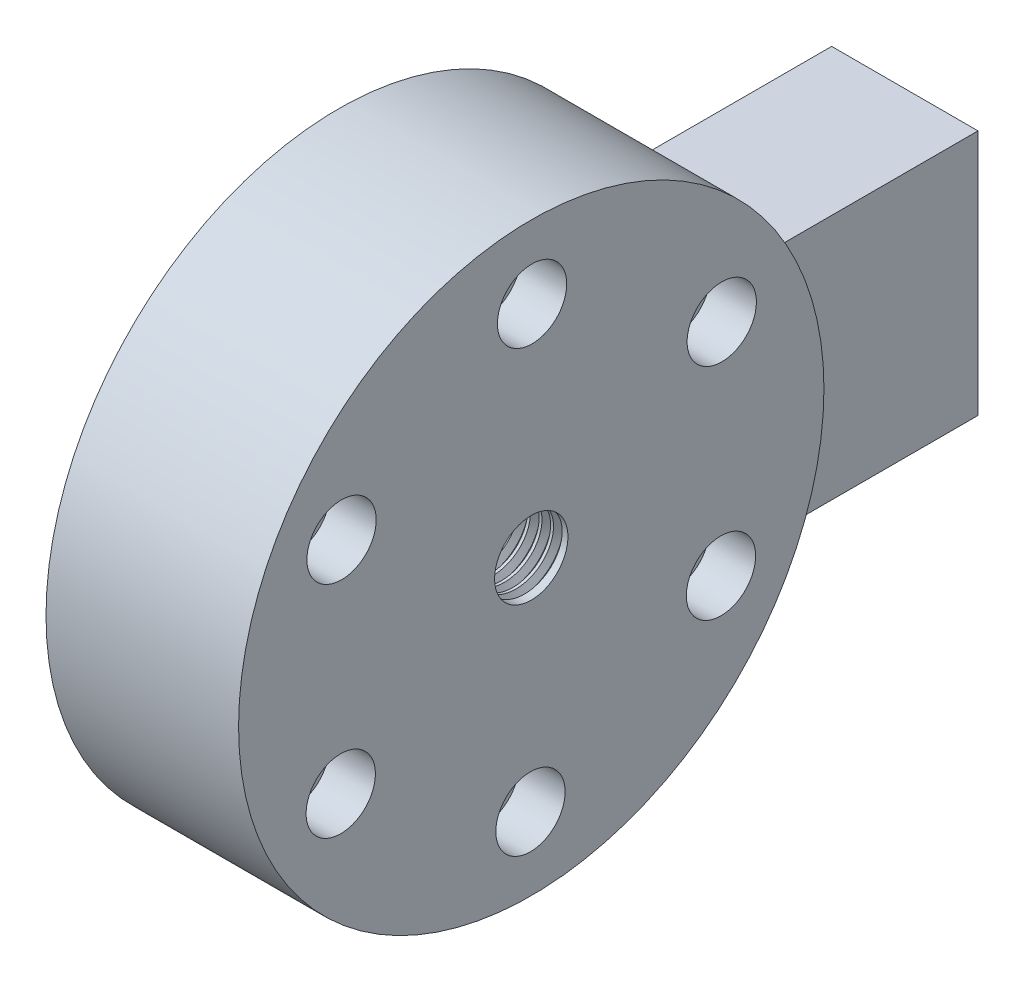
from build123d import *

# Parameters (mm, degrees)
SKETCH1_R                       = 38
BOSS_EXTRUDE1_DEPTH             = 25
SKETCH2_R                       = 3.5
CUT_EXTRUDE1_DEPTH              = 25
SKETCH3_R                       = 4.5
CUT_EXTRUDE2_DEPTH              = 6
SKETCH4_R                       = 4.7625
CUT_EXTRUDE3_DEPTH              = 60.270566
THREAD1_PITCH                   = 1.5
BOSS_EXTRUDE2_REACH             = 90.572
BOSS_EXTRUDE2_END_RADIUS        = 38
SKETCH8_W                       = 19
SKETCH8_H                       = 32
BOSS_EXTRUDE2_DIRECTION_2_DEPTH = 23


with BuildPart() as part:
    # Sketch1 → Boss-Extrude1 (new body)
    with BuildSketch(Plane(origin=(0, 0, 0), x_dir=(0, 0, -1), z_dir=(1, 0, 0))):
        Circle(SKETCH1_R)
    extrude(amount=BOSS_EXTRUDE1_DEPTH)

    # Sketch2 → Cut-Extrude1 (cut)
    with BuildSketch(Plane(origin=(25, 0, 0), x_dir=(0, 0, -1), z_dir=(1, 0, 0))):
        with Locations((0.103808, 28.499811)):
            Circle(SKETCH2_R)
        with Locations((24.733464, 14.160005)):
            Circle(SKETCH2_R)
        with Locations((24.629656, -14.339806)):
            Circle(SKETCH2_R)
        with Locations((-0.103808, -28.499811)):
            Circle(SKETCH2_R)
        with Locations((-24.733464, -14.160005)):
            Circle(SKETCH2_R)
        with Locations((-24.629656, 14.339806)):
            Circle(SKETCH2_R)
    extrude(amount=-CUT_EXTRUDE1_DEPTH, mode=Mode.SUBTRACT)

    # Sketch3 → Cut-Extrude2 (cut)
    with BuildSketch(Plane(origin=(25, 0, 0), x_dir=(0, 0, -1), z_dir=(1, 0, 0))):
        with Locations((0.103808, 28.499811)):
            Circle(SKETCH3_R)
        with Locations((24.733464, 14.160005)):
            Circle(SKETCH3_R)
        with Locations((24.629656, -14.339806)):
            Circle(SKETCH3_R)
        with Locations((-0.103808, -28.499811)):
            Circle(SKETCH3_R)
        with Locations((-24.733464, -14.160005)):
            Circle(SKETCH3_R)
        with Locations((-24.629656, 14.339806)):
            Circle(SKETCH3_R)
    extrude(amount=-CUT_EXTRUDE2_DEPTH, mode=Mode.SUBTRACT)

    # Sketch4 → Cut-Extrude3 (cut, through all)
    with BuildSketch(Plane(origin=(25, 0, 0), x_dir=(0, 0, -1), z_dir=(1, 0, 0))):
        Circle(SKETCH4_R)
    extrude(amount=-CUT_EXTRUDE3_DEPTH, mode=Mode.SUBTRACT)

    # Thread1: arcs per turn and ends read off the stored shape
    # Thread1: the profile of Thread Profile1 profile screwed along a right-hand helix through 16.666667 turns, 8 arcs to a turn; built about Z, then put on its axis
    thread1_z = Axis((0, 0, 0), (0, 0, 1))
    thread1_corners = [(4.7622, 0, -0.000173), (5.574399, 0, 0.46875), (5.574399, 0, 0.65625), (4.7622, 0, 1.125173)]
    with BuildLine(mode=Mode.PRIVATE) as thread1_profile:
        Line(thread1_corners[0], thread1_corners[1])
        Line(thread1_corners[1], thread1_corners[2])
        Line(thread1_corners[2], thread1_corners[3])
        Line(thread1_corners[3], thread1_corners[0])
    thread1_cap = Face(thread1_profile.wire())
    thread1_turn_angles = [0, 22.5, 45, 67.5, 90, 112.5, 135, 157.5, 180, 202.5, 225, 247.5, 270, 292.5, 315, 337.5, 360]
    thread1_turn_weights = [1, 0.9238795325112867, 1, 0.9238795325112867, 1, 0.9238795325112867, 1, 0.9238795325112867, 1, 0.9238795325112867, 1, 0.9238795325112867, 1, 0.9238795325112867, 1, 0.9238795325112867, 1]
    thread1_turn_rails = [Edge.make_bspline([Vector(p[0], p[1], 0).rotate(thread1_z, thread1_turn_angles[k]) / thread1_turn_weights[k] + Vector(0, 0, p[2] + THREAD1_PITCH * thread1_turn_angles[k] / 360) for k in range(17)], [0, 0, 0, 1, 1, 2, 2, 3, 3, 4, 4, 5, 5, 6, 6, 7, 7, 8, 8, 8], 2, thread1_turn_weights) for p in thread1_corners]
    thread1_turn_sides = [Face.make_surface_from_curves(thread1_turn_rails[p[0]], thread1_turn_rails[p[1]]) for p in [(0, 1), (1, 2), (2, 3), (3, 0)]]
    thread1_last_angles = [5760, 5782.5, 5805, 5827.5, 5850, 5872.5, 5895, 5917.5, 5940, 5962.5, 5985, 5992.5, 6000]
    thread1_last_weights = [1, 0.9238795325112867, 1, 0.9238795325112867, 1, 0.9238795325112867, 1, 0.9238795325112867, 1, 0.9238795325112867, 1, 0.9914448613738115, 1]
    thread1_last_rails = [Edge.make_bspline([Vector(p[0], p[1], 0).rotate(thread1_z, thread1_last_angles[k]) / thread1_last_weights[k] + Vector(0, 0, p[2] + THREAD1_PITCH * thread1_last_angles[k] / 360) for k in range(13)], [0, 0, 0, 1, 1, 2, 2, 3, 3, 4, 4, 5, 5, 6, 6, 6], 2, thread1_last_weights) for p in thread1_corners]
    thread1_last_sides = [Face.make_surface_from_curves(thread1_last_rails[p[0]], thread1_last_rails[p[1]]) for p in [(0, 1), (1, 2), (2, 3), (3, 0)]]
    thread1 = Plane(origin=(25, 0, 0), x_dir=(0, 0, 1), z_dir=(-1, 0, 0)) * Solid(Shell([*[p.moved(Location((0, 0, THREAD1_PITCH * i))) for i in range(16) for p in thread1_turn_sides], *thread1_last_sides, thread1_cap, thread1_cap.rotate(thread1_z, 6000).moved(Location((0, 0, THREAD1_PITCH * 6000 / 360)))]))
    add(thread1, mode=Mode.SUBTRACT)

    # Boss-Extrude2: up to this cylinder (the profile starts outside it)
    boss_extrude2_end = Plane(origin=(12.5, 0, 0), z_dir=(-1, 0, 0)) * Cylinder(BOSS_EXTRUDE2_END_RADIUS, 258.144, mode=Mode.PRIVATE)
    # Sketch8 → Boss-Extrude2 (add, up to the surface)
    with BuildSketch(Plane.XY.offset(-38), mode=Mode.PRIVATE) as boss_extrude2_sk1:
        with Locations((12.5, 0)):
            Rectangle(SKETCH8_W, SKETCH8_H)
    boss_extrude2_tool1 = extrude(boss_extrude2_sk1.sketch, amount=BOSS_EXTRUDE2_REACH, mode=Mode.PRIVATE) - boss_extrude2_end
    add(boss_extrude2_tool1.solids().sort_by_distance((12.5, 0, -38))[0])
    add(boss_extrude2_tool1.solids().sort_by_distance((12.5, 0, -38))[1])

    # Sketch8 → Boss-Extrude2 direction 2 (add)
    with BuildSketch(Plane.XY.offset(-38)):
        with Locations((12.5, 0)):
            Rectangle(SKETCH8_W, SKETCH8_H)
    extrude(amount=-BOSS_EXTRUDE2_DIRECTION_2_DEPTH)


solid = part.part
